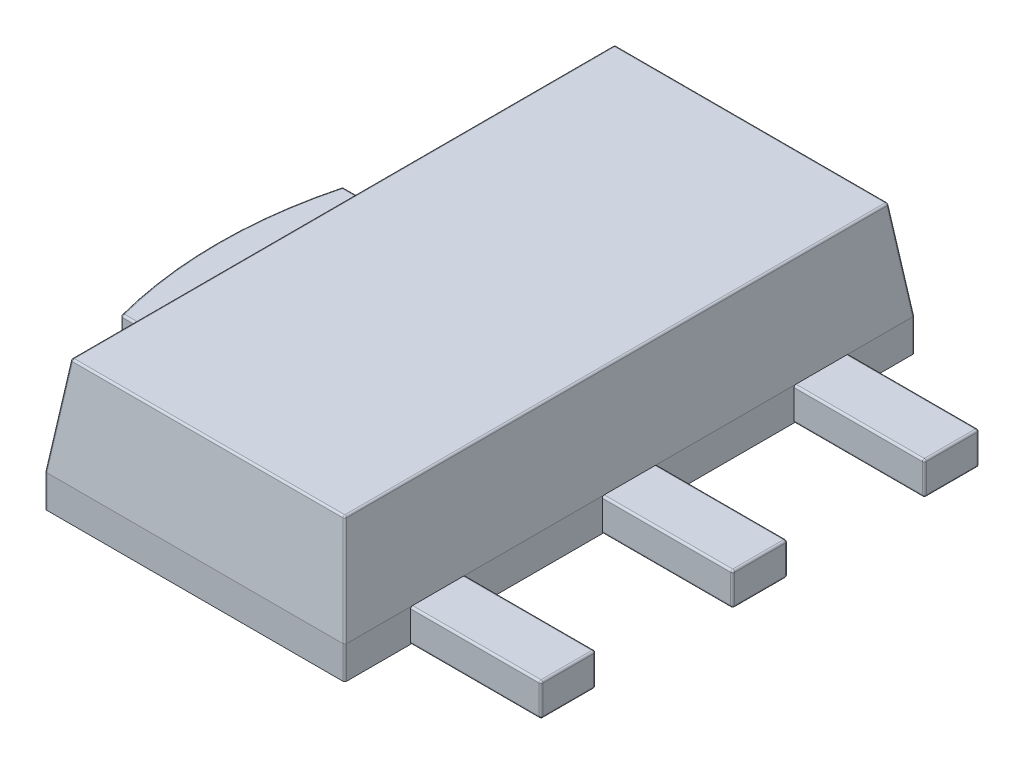
from build123d import *

# Parameters (mm, degrees)
SKETCH1_W           = 2.3
SKETCH1_H           = 4.37
BOSS_EXTRUDE1_DEPTH = 0.5
CUT_EXTRUDE1_DEPTH  = 5.546361182
CUT_EXTRUDE2_DEPTH  = 4.211576716
FILLET1_R           = 0.015
SKETCH6_W           = 1
SKETCH6_H           = 0.42
BOSS_EXTRUDE2_DEPTH = 0.25
FILLET2_R           = 0.015


with BuildPart() as part:
    # Sketch1 → Boss-Extrude1 (new, symmetric)
    with BuildSketch(Plane(origin=(0, 0, 0), x_dir=(1, 0, 0), z_dir=(0, 1, 0))):
        Rectangle(SKETCH1_W, SKETCH1_H)
    extrude(amount=BOSS_EXTRUDE1_DEPTH, both=True)

    # Sketch2 → Cut-Extrude1 (cut, through all)
    with BuildSketch(Plane.XY.offset(2.185)):
        Polygon((-1.15, -0.25), (-1.15, 0.5), (-1.05, 0.5), align=None)
        Polygon((1.05, 0.5), (1.15, -0.25), (1.15, 0.5), align=None)
    extrude(amount=-CUT_EXTRUDE1_DEPTH, mode=Mode.SUBTRACT)

    # Sketch3 → Cut-Extrude2 (cut, through all)
    with BuildSketch(Plane(origin=(1.15, 0, 0), x_dir=(0, 0, -1), z_dir=(1, 0, 0))):
        Polygon((-2.185, -0.25), (-2.185, 0.5), (-2.085, 0.5), align=None)
        Polygon((2.085, 0.5), (2.185, -0.25), (2.185, 0.5), align=None)
    extrude(amount=-CUT_EXTRUDE2_DEPTH, mode=Mode.SUBTRACT)

    # Fillet1
    fillet1_edges = [part.edges().sort_by_distance(p)[0] for p in [
        (0, 0.5, -2.085),
        (1.05, 0.5, 0),
        (0, 0.5, 2.085),
        (-1.05, 0.5, 0),
        (-1.15, -0.375, 2.185),
        (-1.1, 0.125, 2.135),
        (-1.15, -0.375, -2.185),
        (-1.1, 0.125, -2.135),
        (1.15, -0.375, -2.185),
        (1.1, 0.125, -2.135),
        (1.1, 0.125, 2.135),
        (1.15, -0.375, 2.185),
    ]]
    fillet(fillet1_edges, radius=FILLET1_R)

    # Sketch6 → Boss-Extrude2 (add)
    with BuildSketch(Plane.XZ.offset(0.5)):
        with Locations((1.65, 1.47)):
            Rectangle(SKETCH6_W, SKETCH6_H)
        with Locations((1.65, 0)):
            Rectangle(SKETCH6_W, SKETCH6_H)
        with Locations((1.65, -1.47)):
            Rectangle(SKETCH6_W, SKETCH6_H)
        with BuildLine():
            Line((-1.9, 0.85), (-1.15, 0.85))
            Line((-1.15, 0.85), (-1.15, -0.85))
            Line((-1.15, -0.85), (-1.9, -0.85))
            ThreePointArc((-1.9, -0.85), (-2.011348247, 0), (-1.9, 0.85))
        make_face()
    extrude(amount=-BOSS_EXTRUDE2_DEPTH)

    # Fillet2
    fillet2_edges = [part.edges().sort_by_distance(p)[0] for p in [
        (2.15, -0.375, 1.68),
        (2.15, -0.25, 1.47),
        (2.15, -0.375, 1.26),
        (2.15, -0.5, 1.47),
        (-1.525, -0.5, 0.85),
        (-1.525, -0.25, 0.85),
        (-1.9, -0.375, 0.85),
        (-2.011348247, -0.5, 0),
        (-1.525, -0.5, -0.85),
        (-1.9, -0.375, -0.85),
        (-2.011348247, -0.25, 0),
        (-1.525, -0.25, -0.85),
        (1.65, -0.5, -1.26),
        (2.15, -0.5, -1.47),
        (1.65, -0.5, -1.68),
        (2.15, -0.375, -1.68),
        (2.15, -0.375, -1.26),
        (1.65, -0.25, -1.26),
        (2.15, -0.25, -1.47),
        (1.65, -0.25, -1.68),
        (1.65, -0.5, -0.21),
        (2.15, -0.5, 0),
        (2.15, -0.375, -0.21),
        (2.15, -0.375, 0.21),
        (2.15, -0.25, 0),
        (1.65, -0.25, -0.21),
        (1.65, -0.5, 0.21),
        (1.65, -0.25, 0.21),
        (1.65, -0.5, 1.68),
        (1.65, -0.25, 1.26),
        (1.65, -0.5, 1.26),
        (1.65, -0.25, 1.68),
    ]]
    fillet(fillet2_edges, radius=FILLET2_R)


solid = part.part
